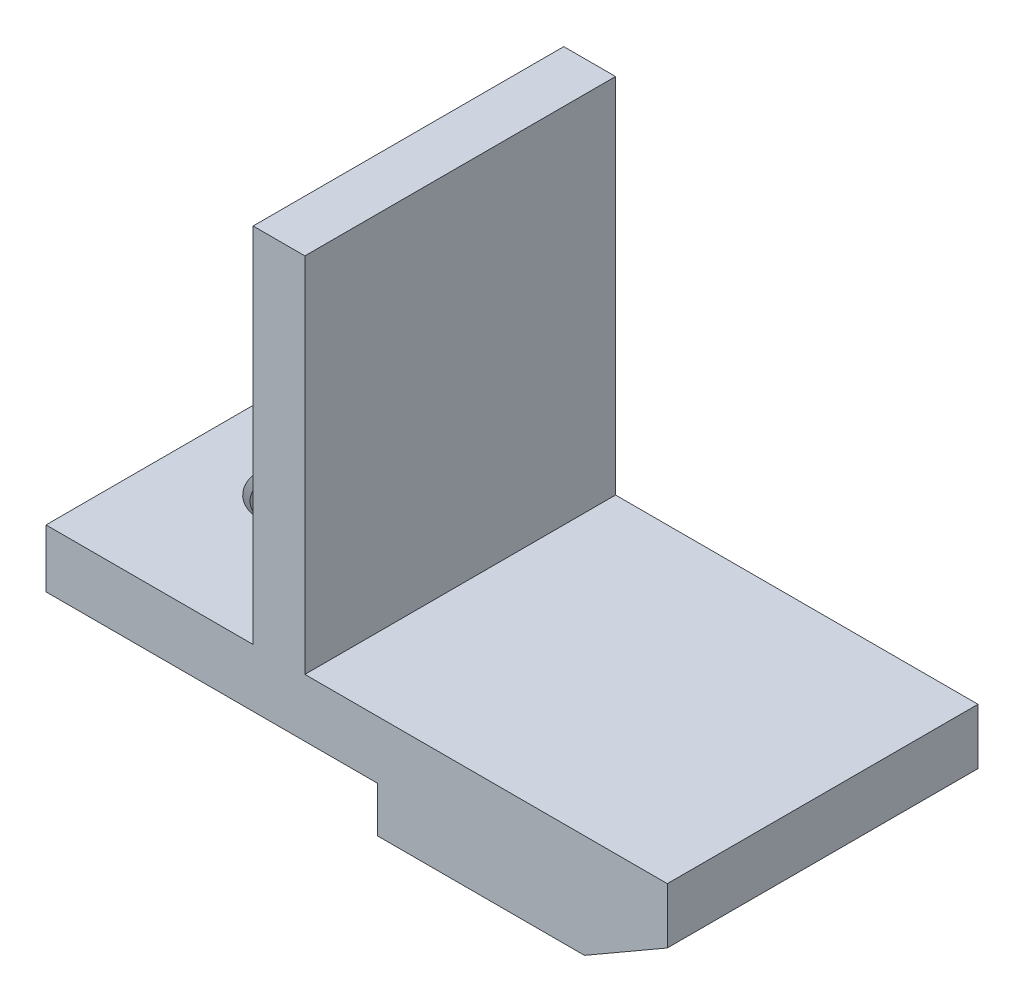
from build123d import *

# Parameters (mm, degrees)
BOSS_EXTRUDE1_DEPTH                    = 38.1
F_3_8_0_375_DIAMETER_HOLE1_D           = 9.525
F_3_8_0_375_DIAMETER_HOLE1_CSINK_D     = 10.795
F_3_8_0_375_DIAMETER_HOLE1_CSINK_ANGLE = 90
CHAMFER1_SIZE                          = 10.16
CHAMFER1_SIZE2                         = 5.865878735


with BuildPart() as part:
    # Sketch1 → Boss-Extrude1 (new body)
    with BuildSketch(Plane.XY):
        Polygon((0, 0), (44.45, 0), (44.45, -12.7), (8.89, -12.7), (8.89, -7.112), (-31.75, -7.112), (-31.75, 0), (-6.35, 0), (-6.35, 44.45), (0, 44.45), align=None)
    extrude(amount=BOSS_EXTRUDE1_DEPTH)

    # 3/8 (0.375) Diameter Hole1 (through all)
    with Locations(Plane(origin=(0, 0, 0), x_dir=(1, 0, 0), z_dir=(0, 1, 0))):
        with Locations((-19.05, -19.05)):
            CounterSinkHole(F_3_8_0_375_DIAMETER_HOLE1_D / 2, F_3_8_0_375_DIAMETER_HOLE1_CSINK_D / 2, counter_sink_angle=F_3_8_0_375_DIAMETER_HOLE1_CSINK_ANGLE)

    # Chamfer1
    chamfer1_edges = [part.edges().sort_by_distance(p)[0] for p in [
        (44.45, -12.7, 19.05),
    ]]
    chamfer1_side = [part.faces().sort_by_distance(p)[0] for p in [
        (26.67, -12.7, 19.05),
    ]]
    chamfer(chamfer1_edges, length=CHAMFER1_SIZE, length2=CHAMFER1_SIZE2, reference=chamfer1_side[0])


solid = part.part
